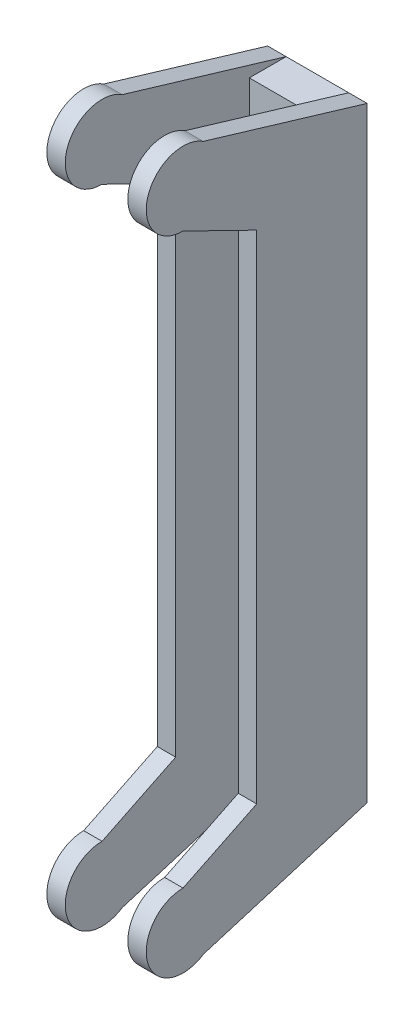
from build123d import *

# Parameters (mm, degrees)
SALIENTE_EXTRUIR1_DEPTH = 5
CROQUIS3_W              = 10
CROQUIS3_H              = 164.5
SALIENTE_EXTRUIR2_DEPTH = 10
VACIADO1_START          = -74.25
VACIADO1_OUTLINE_W      = 11
VACIADO1_OUTLINE_H      = 2
VACIADO1_DEPTH          = 148.5


# Read off the part's stored shape, not the designer's step: Vaciado1
with BuildPart() as part:
    # Croquis1 → Saliente-Extruir1 (new body)
    with BuildSketch(Plane(origin=(0, 0, 0), x_dir=(0, 0, -1), z_dir=(1, 0, 0))):
        with BuildLine():
            Line((-29.506547344, 95.56963472), (15, 82.25))
            Line((15, 82.25), (15, -82.25))
            Line((15, -82.25), (-29.472062031, -95.659500692))
            ThreePointArc((-29.472062031, -95.659500692), (-44.574231242, -90.213203382), (-35, -77.326319918))
            Line((-35, -77.326319918), (-15, -67.539809421))
            Line((-15, -67.539809421), (-15, 67.43308889))
            Line((-15, 67.43308889), (-35, 77.213680082))
            ThreePointArc((-35, 77.213680082), (-44.580176052, 90.080773873), (-29.506547344, 95.56963472))
        make_face()
    extrude(amount=SALIENTE_EXTRUIR1_DEPTH)


with BuildPart() as body_2:
    # Simetría3: mirrored copy
    add(part.part.mirror(Plane(origin=(-8.5, 0, 0), x_dir=(0, 0, 1), z_dir=(1, 0, 0))))


with BuildPart() as part_1:
    add(part.part)

    add(body_2.part)  # Saliente-Extruir2 merges body 2
    # Croquis3 → Saliente-Extruir2 (add, symmetric)
    with BuildSketch(Plane(origin=(-8.5, 0, 0), x_dir=(0, 0, -1), z_dir=(1, 0, 0))):
        with Locations((10, 0)):
            Rectangle(CROQUIS3_W, CROQUIS3_H)
    extrude(amount=SALIENTE_EXTRUIR2_DEPTH, both=True)

    # Vaciado1 outline → Vaciado1 (cut)
    with BuildSketch(Plane(origin=(0, 0, 0), x_dir=(1, 0, 0), z_dir=(0, 1, 0)).offset(VACIADO1_START)):
        with Locations((-8.5, 6)):
            Rectangle(VACIADO1_OUTLINE_W, VACIADO1_OUTLINE_H)
    extrude(amount=VACIADO1_DEPTH, mode=Mode.SUBTRACT)


solid = part_1.part
